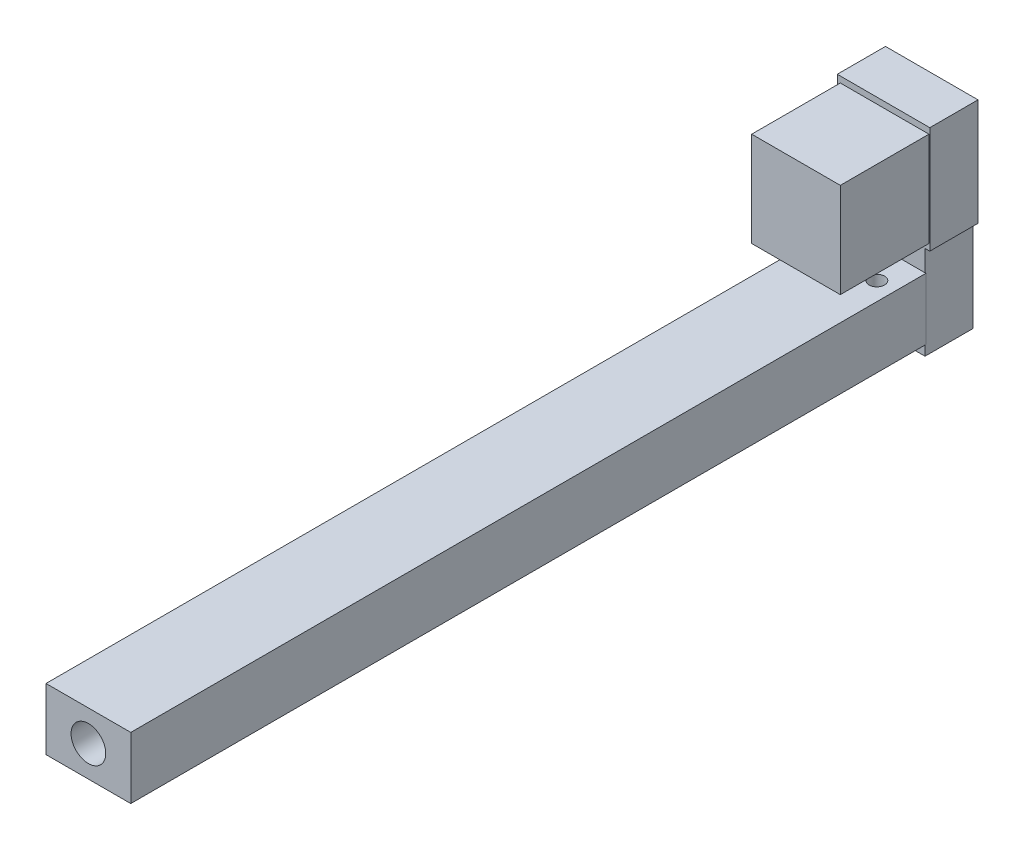
from build123d import *

# Parameters (mm, degrees)
SKETCH1_W               = 1310.386
SKETCH1_H               = 101.6
BOSS_EXTRUDE1_DEPTH     = 69.85
BOSS_EXTRUDE2_DEPTH     = 68.326
SKETCH3_W               = 79.430838384
SKETCH3_H               = 176.27
BOSS_EXTRUDE3_DEPTH     = 76.23
SKETCH4_W               = 146.04
SKETCH4_H               = 156.04
BOSS_EXTRUDE4_DEPTH     = 146.05
SKETCH5_R               = 28.575
CUT_EXTRUDE1_DEPTH      = 927.1
CUT_EXTRUDE2_DEPTH      = 10
CUT_EXTRUDE2_DEPTH_BACK = 1330.46311815
SKETCH6_R               = 12.7


with BuildPart() as part:
    # Sketch1 → Boss-Extrude1 (new, symmetric)
    with BuildSketch(Plane(origin=(0, 0, 0), x_dir=(0, 0, -1), z_dir=(1, 0, 0))):
        with Locations((-655.193, 0)):
            Rectangle(SKETCH1_W, SKETCH1_H)
    extrude(amount=BOSS_EXTRUDE1_DEPTH, both=True)

    # Sketch2 → Boss-Extrude2 (add, symmetric)
    with BuildSketch(Plane(origin=(0, 0, 0), x_dir=(0, 0, -1), z_dir=(1, 0, 0))):
        Polygon((0, 0), (0, -68.326), (79.430838384, -68.326), (79.430838384, 85.598), (0, 85.598), align=None)
    extrude(amount=BOSS_EXTRUDE2_DEPTH, both=True)

    # Sketch3 → Boss-Extrude3 (add, symmetric)
    with BuildSketch(Plane(origin=(0, 0, 0), x_dir=(0, 0, -1), z_dir=(1, 0, 0))):
        with Locations((39.715419192, 173.733)):
            Rectangle(SKETCH3_W, SKETCH3_H)
    extrude(amount=BOSS_EXTRUDE3_DEPTH, both=True)

    # Sketch4 → Boss-Extrude4 (add)
    with BuildSketch(Plane.XY):
        with Locations((1.79, 173.848)):
            Rectangle(SKETCH4_W, SKETCH4_H)
    extrude(amount=BOSS_EXTRUDE4_DEPTH)

    # Sketch5 → Cut-Extrude1 (cut)
    with BuildSketch(Plane.XY.offset(1310.386)):
        Circle(SKETCH5_R)
    extrude(amount=-CUT_EXTRUDE1_DEPTH, mode=Mode.SUBTRACT)

    # Sketch6 → Cut-Extrude2 (cut, two sides: drawn at the far end of the back side and taken through both)
    with BuildSketch(Plane(origin=(0, 50.8, 0), x_dir=(1, 0, 0), z_dir=(0, 1, 0)).offset(-CUT_EXTRUDE2_DEPTH_BACK)):
        with Locations((39.81, -50.8)):
            Circle(SKETCH6_R)
    extrude(amount=CUT_EXTRUDE2_DEPTH + CUT_EXTRUDE2_DEPTH_BACK, mode=Mode.SUBTRACT)


solid = part.part
